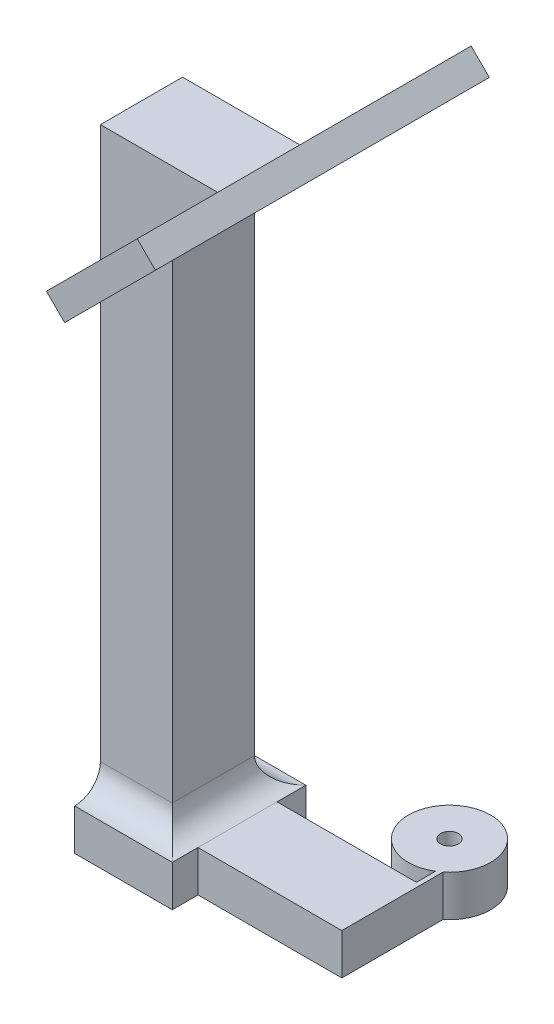
from build123d import *

# Parameters (mm, degrees)
BOSS_EXTRUDE2_DEPTH      = 65
CUT_EXTRUDE1_DEPTH       = 82.266390279
CUT_EXTRUDE1_DEPTH_BACK  = 82.266390279
SKETCH4_R                = 1.75
BOSS_EXTRUDE3_DEPTH      = 8
BOSS_EXTRUDE3_DEPTH_BACK = 8
BOSS_EXTRUDE3_START      = -32.5
SKETCH9_W                = 14
SKETCH9_H                = 16
BOSS_EXTRUDE4_DEPTH      = 100
SKETCH10_R               = 1.75
BOSS_EXTRUDE5_DEPTH      = 8
FILLET4_R                = 5


with BuildPart() as part:
    # Sketch3 → Boss-Extrude2 (new body)
    with BuildSketch(Plane.XY):
        Polygon((-3.535533906, 33.535533906), (0, 30), (17.67766953, 47.67766953), (14.142135624, 51.213203436), align=None)
    extrude(amount=-BOSS_EXTRUDE2_DEPTH)

    # Sketch4 → Cut-Extrude1 (cut, two sides: drawn at the far end of the back side and taken through both)
    with BuildSketch(Plane(origin=(-18.535533906, 18.535533906, 0), x_dir=(0, 0, 1), z_dir=(-0.7071067811865477, 0.7071067811865475, 0)).offset(-CUT_EXTRUDE1_DEPTH_BACK)):
        with Locations(Location((-10, 33.713203436, 0), (0, 0, 270))):
            Circle(SKETCH4_R)
        with Locations(Location((-55, 33.713203436, 0), (0, 0, 270))):
            Circle(SKETCH4_R)
    extrude(amount=CUT_EXTRUDE1_DEPTH + CUT_EXTRUDE1_DEPTH_BACK, mode=Mode.SUBTRACT)

    # Sketch8 → Boss-Extrude3 (add, two sides: drawn at the far end of the back side and taken through both)
    with BuildSketch(Plane(origin=(0, 0, -65), x_dir=(-1, 0, 0), z_dir=(0, 0, -1)).offset(BOSS_EXTRUDE3_START - BOSS_EXTRUDE3_DEPTH_BACK)):
        Polygon((-5.303300859, 42.374368671), (17.535533906, 42.374368671), (17.535533906, 30), (0, 30), (3.535533906, 33.535533906), align=None)
    extrude(amount=BOSS_EXTRUDE3_DEPTH + BOSS_EXTRUDE3_DEPTH_BACK)

    # Sketch9 → Boss-Extrude4 (add)
    with BuildSketch(Plane.XZ.offset(-30)):
        with Locations((-10.535533906, -32.5)):
            Rectangle(SKETCH9_W, SKETCH9_H)
    extrude(amount=BOSS_EXTRUDE4_DEPTH)

    # Sketch10 → Boss-Extrude5 (add)
    with BuildSketch(Plane.XZ.offset(70)):
        with BuildLine():
            Line((29.465894629, -44.217395538), (29.465894629, -24.5))
            Line((29.465894629, -24.5), (1.464466094, -24.5))
            Line((1.464466094, -24.5), (1.464466094, -19.5))
            Line((1.464466094, -19.5), (-17.535533906, -19.5))
            Line((-17.535533906, -19.5), (-17.535533906, -45.5))
            Line((-17.535533906, -45.5), (1.464466094, -45.5))
            Line((1.464466094, -45.5), (1.464466094, -39.889528684))
            Line((1.464466094, -39.889528684), (28.589308321, -39.889528684))
            Line((28.589308321, -39.889528684), (28.589308321, -43.606924222))
            ThreePointArc((28.589308321, -43.606924222), (19.893987133, -57.027274483), (29.465894629, -44.217395538))
        make_face()
        with Locations(Location((24.465894629, -50.462393537, 0), (0, 0, 270))):
            Circle(SKETCH10_R, mode=Mode.SUBTRACT)
    extrude(amount=BOSS_EXTRUDE5_DEPTH)

    # Fillet4
    fillet4_edges = [part.edges().sort_by_distance(p)[0] for p in [
        (-10.535533906, -70, -40.5),
        (-10.535533906, -70, -24.5),
        (-3.535533906, -70, -32.5),
    ]]
    fillet(fillet4_edges, radius=FILLET4_R - 0.0001)  # a hair under: the kernel refuses the full size


solid = part.part
